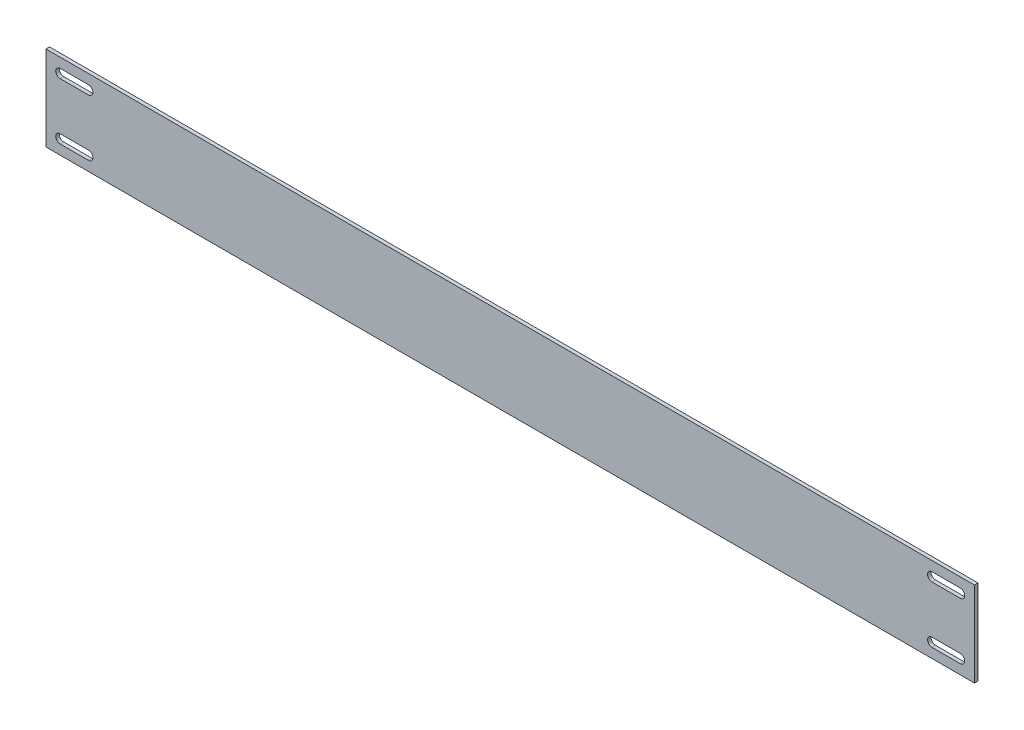
from build123d import *

# Parameters (mm, degrees)
BOSS_EXTRUDE1_DEPTH = 38.1
CUT_EXTRUDE2_DEPTH  = 419.301761598


with BuildPart() as part:
    # Sketch1 → Boss-Extrude1 (new body)
    with BuildSketch(Plane(origin=(0, 0, 0), x_dir=(1, 0, 0), z_dir=(0, 1, 0))):
        Polygon((0, 0), (416.56, 0), (416.56, 1.5875), (391.16, 1.5875), (25.4, 1.5875), (0, 1.5875), align=None)
    extrude(amount=BOSS_EXTRUDE1_DEPTH)

    # Sketch2 → Cut-Extrude2 (cut, through all)
    with BuildSketch(Plane(origin=(0, 0, -1.5875), x_dir=(-1, 0, 0), z_dir=(0, 0, -1))):
        with BuildLine():
            Line((-6.35, 33.734375), (-19.05, 33.734375))
            ThreePointArc((-19.05, 33.734375), (-21.034375, 31.75), (-19.05, 29.765625))
            Line((-19.05, 29.765625), (-6.35, 29.765625))
            ThreePointArc((-6.35, 29.765625), (-4.365625, 31.75), (-6.35, 33.734375))
        make_face()
        with BuildLine():
            ThreePointArc((-19.05, 8.334375), (-21.034375, 6.35), (-19.05, 4.365625))
            Line((-19.05, 4.365625), (-6.35, 4.365625))
            ThreePointArc((-6.35, 4.365625), (-4.365625, 6.35), (-6.35, 8.334375))
            Line((-6.35, 8.334375), (-19.05, 8.334375))
        make_face()
        with BuildLine():
            Line((-410.21, 4.365625), (-397.51, 4.365625))
            ThreePointArc((-397.51, 4.365625), (-395.525625, 6.35), (-397.51, 8.334375))
            Line((-397.51, 8.334375), (-410.21, 8.334375))
            ThreePointArc((-410.21, 8.334375), (-412.194375, 6.35), (-410.21, 4.365625))
        make_face()
        with BuildLine():
            ThreePointArc((-397.51, 29.765625), (-395.525625, 31.75), (-397.51, 33.734375))
            Line((-397.51, 33.734375), (-410.21, 33.734375))
            ThreePointArc((-410.21, 33.734375), (-412.194375, 31.75), (-410.21, 29.765625))
            Line((-410.21, 29.765625), (-397.51, 29.765625))
        make_face()
    extrude(amount=-CUT_EXTRUDE2_DEPTH, mode=Mode.SUBTRACT)


solid = part.part
